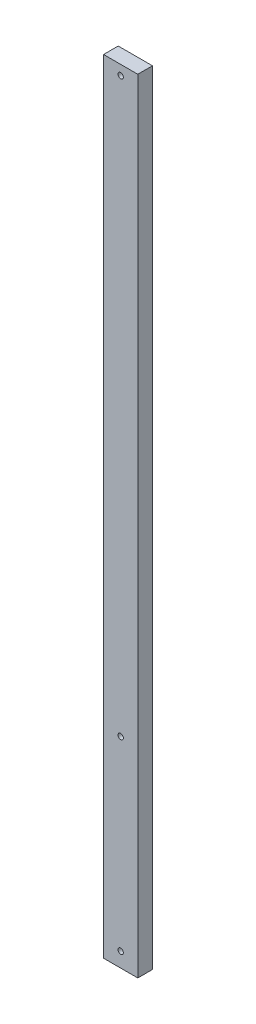
from build123d import *

# Parameters (mm, degrees)
SKETCH1_W               = 88.9
SKETCH1_H               = 38.1
BOSS_EXTRUDE1_DEPTH     = 2032
CUT_EXTRUDE1_DEPTH      = 2033.843184434
CUT_EXTRUDE1_DEPTH_BACK = 2033.843184434
SKETCH2_R               = 6.985


with BuildPart() as part:
    # Sketch1 → Boss-Extrude1 (new body)
    with BuildSketch(Plane(origin=(0, 0, 0), x_dir=(1, 0, 0), z_dir=(0, 1, 0))):
        Rectangle(SKETCH1_W, SKETCH1_H)
    extrude(amount=BOSS_EXTRUDE1_DEPTH)

    # Sketch2 → Cut-Extrude1 (cut, two sides: drawn at the far end of the back side and taken through both)
    with BuildSketch(Plane.XY.offset(19.05).offset(-CUT_EXTRUDE1_DEPTH_BACK)):
        with Locations((0, 38.1)):
            Circle(SKETCH2_R)
        with Locations((0, 520.7)):
            Circle(SKETCH2_R)
        with Locations((0, 2006.6)):
            Circle(SKETCH2_R)
    extrude(amount=CUT_EXTRUDE1_DEPTH + CUT_EXTRUDE1_DEPTH_BACK, mode=Mode.SUBTRACT)


solid = part.part
